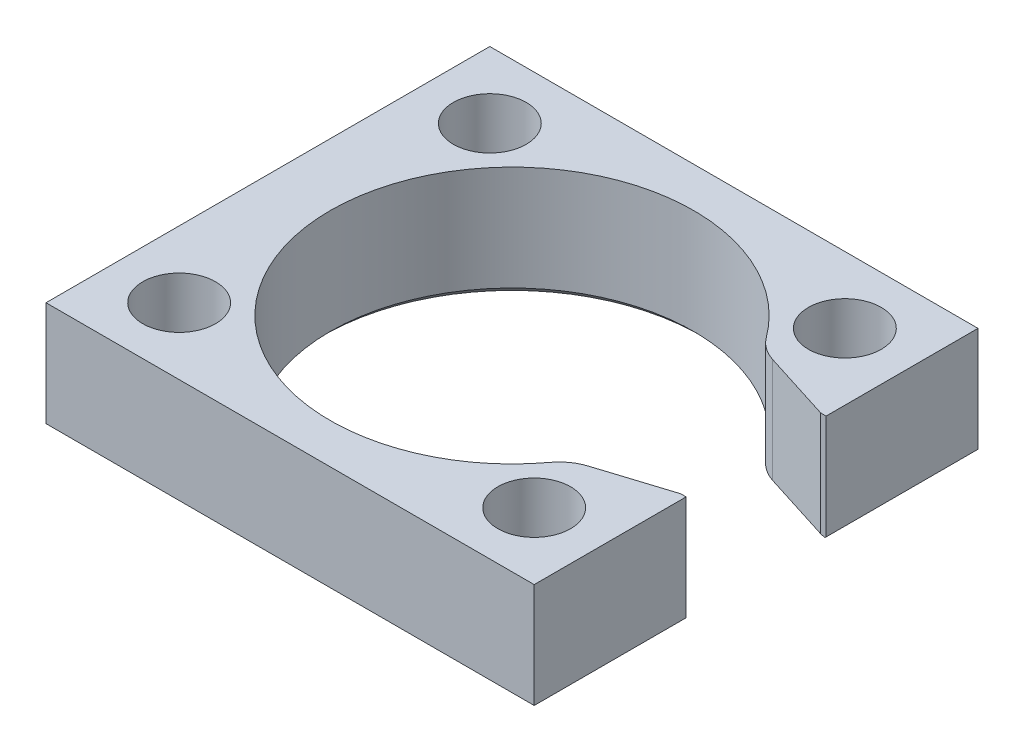
from build123d import *

# Parameters (mm, degrees)
SKETCH1_W              = 34.925
SKETCH1_H              = 31.75
PLATE_DEPTH            = 4
F_10_CLEARANCE_HOLE1_D = 5.1054
LOAD_CELL_CUTOUT_REACH = 26.919
FILLET1_R              = 3.175
CUT_EXTRUDE1_REACH     = 26.919
SKETCH5_R              = 2.6035
CHAMFER1_SIZE          = 0.508


with BuildPart() as part:
    # Sketch1 → Plate (new, symmetric)
    with BuildSketch(Plane(origin=(0, 0, 0), x_dir=(1, 0, 0), z_dir=(0, 1, 0))):
        Rectangle(SKETCH1_W, SKETCH1_H)
    extrude(amount=PLATE_DEPTH, both=True)

    # #10 Clearance Hole1 (through all)
    with Locations(Plane(origin=(0, 4, 0), x_dir=(1, 0, 0), z_dir=(0, 1, 0))):
        with Locations((-12.7, 11.1125), (12.7, 11.1125), (12.7, -11.1125), (-12.7, -11.1125)):
            Hole(F_10_CLEARANCE_HOLE1_D / 2)

    # Sketch4 → Load Cell Cutout (cut, up to next)
    with BuildSketch(Plane(origin=(0, 4, 0), x_dir=(1, 0, 0), z_dir=(0, 1, 0)), mode=Mode.PRIVATE) as load_cell_cutout_sk1:
        with BuildLine():
            Line((11.009869163, 6.927542495), (17.078427656, 5.008))
            Line((17.078427656, 5.008), (22.733, 5.008))
            Line((22.733, 5.008), (22.733, -5.008))
            Line((22.733, -5.008), (17.078427656, -5.008))
            Line((17.078427656, -5.008), (11.009869163, -6.927542495))
            ThreePointArc((11.009869163, -6.927542495), (-13.008, 0), (11.009869163, 6.927542495))
        make_face()
    load_cell_cutout_tool1 = extrude(load_cell_cutout_sk1.sketch, amount=-LOAD_CELL_CUTOUT_REACH, mode=Mode.PRIVATE) & part.part
    add(load_cell_cutout_tool1.solids().sort_by_distance((2.977457, 4, 0))[0], mode=Mode.SUBTRACT)

    # Fillet1
    fillet1_edges = [part.edges().sort_by_distance(p)[0] for p in [
        (11.009869163, 0, 6.927542495),
        (11.009869163, 0, -6.927542495),
    ]]
    fillet(fillet1_edges, radius=FILLET1_R)

    # Sketch5 → Cut-Extrude1 (cut, up to next)
    with BuildSketch(Plane(origin=(0, 4, 0), x_dir=(1, 0, 0), z_dir=(0, 1, 0)), mode=Mode.PRIVATE) as cut_extrude1_sk1:
        with Locations(Location((-12.7, 11.1125, 0), (0, 0, 270))):
            Circle(SKETCH5_R)
    cut_extrude1_tool1 = extrude(cut_extrude1_sk1.sketch, amount=-CUT_EXTRUDE1_REACH, mode=Mode.PRIVATE) & part.part
    # Sketch5 → Cut-Extrude1 (cut, up to next)
    with BuildSketch(Plane(origin=(0, 4, 0), x_dir=(1, 0, 0), z_dir=(0, 1, 0)), mode=Mode.PRIVATE) as cut_extrude1_sk2:
        with Locations(Location((12.7, 11.1125, 0), (0, 0, 270))):
            Circle(SKETCH5_R)
    cut_extrude1_tool2 = extrude(cut_extrude1_sk2.sketch, amount=-CUT_EXTRUDE1_REACH, mode=Mode.PRIVATE) & part.part
    # Sketch5 → Cut-Extrude1 (cut, up to next)
    with BuildSketch(Plane(origin=(0, 4, 0), x_dir=(1, 0, 0), z_dir=(0, 1, 0)), mode=Mode.PRIVATE) as cut_extrude1_sk3:
        with Locations(Location((-12.7, -11.1125, 0), (0, 0, 270))):
            Circle(SKETCH5_R)
    cut_extrude1_tool3 = extrude(cut_extrude1_sk3.sketch, amount=-CUT_EXTRUDE1_REACH, mode=Mode.PRIVATE) & part.part
    # Sketch5 → Cut-Extrude1 (cut, up to next)
    with BuildSketch(Plane(origin=(0, 4, 0), x_dir=(1, 0, 0), z_dir=(0, 1, 0)), mode=Mode.PRIVATE) as cut_extrude1_sk4:
        with Locations(Location((12.7, -11.1125, 0), (0, 0, 270))):
            Circle(SKETCH5_R)
    cut_extrude1_tool4 = extrude(cut_extrude1_sk4.sketch, amount=-CUT_EXTRUDE1_REACH, mode=Mode.PRIVATE) & part.part
    add(cut_extrude1_tool1.solids().sort_by_distance((-12.7, 4, -11.1125))[0], mode=Mode.SUBTRACT)
    add(cut_extrude1_tool2.solids().sort_by_distance((12.7, 4, -11.1125))[0], mode=Mode.SUBTRACT)
    add(cut_extrude1_tool3.solids().sort_by_distance((-12.7, 4, 11.1125))[0], mode=Mode.SUBTRACT)
    add(cut_extrude1_tool4.solids().sort_by_distance((12.7, 4, 11.1125))[0], mode=Mode.SUBTRACT)

    # Chamfer1
    # the kernel refuses this chamfer: 0.508 mm, written as the material it takes off along each edge
    with BuildSketch(Plane(origin=(13.009505309, -4, -9.625084967), x_dir=(-0.30158215810749167, 0, 0.9534401931485937), z_dir=(0.9534401931485937, 0, 0.30158215810749167))) as chamfer1_piece_1:
        Polygon((3.175 - CHAMFER1_SIZE, 0), (3.175, -CHAMFER1_SIZE), (3.175, 0), align=None)
    revolve(axis=Axis((13.009505309, -4, -9.625084967), (0, -1, 0)), revolution_arc=35.951449602, mode=Mode.SUBTRACT)
    with BuildSketch(Plane(origin=(18.324016186, -4, -4.614008558), x_dir=(0.30146813499365677, -0.02749587661058555, -0.9530797135354744), z_dir=(-0.9534401931485939, 0, -0.30158215810749184)), Plane(origin=(12.051981957, -4, 6.597912354), x_dir=(0.30146813499365605, -0.02749587661058387, 0.9530797135354745), z_dir=(0.9534401931485941, 0, -0.30158215810749117))) as chamfer1_piece_2:
        Polygon((CHAMFER1_SIZE * 0.999621916911, -CHAMFER1_SIZE * 0.0274958766106), (-CHAMFER1_SIZE * 0.0274958766106, -CHAMFER1_SIZE * 0.999621916911), (0, 0), align=None)
    extrude(amount=6.578319516, mode=Mode.SUBTRACT)
    with BuildSketch(Plane(origin=(17.4625, -4, -3.701585042), x_dir=(-0.9996219169112968, -0.027495876610585605, 0), z_dir=(0, 0, -1)), Plane(origin=(17.4625, -4, 17.181414958), x_dir=(-0.9996219169112968, -0.027495876610585605, 0), z_dir=(0, 0, -1))) as chamfer1_piece_3:
        Polygon((CHAMFER1_SIZE * 0.999621916911, CHAMFER1_SIZE * 0.0274958766106), (-CHAMFER1_SIZE * 0.0274958766106, CHAMFER1_SIZE * 0.999621916911), (0, 0), align=None)
    extrude(amount=13.479829916, mode=Mode.SUBTRACT)
    with BuildSketch(Plane(origin=(18.768914958, -4, -15.875), x_dir=(0, -0.027495876610585605, 0.9996219169112968), z_dir=(-1, 0, 0)), Plane(origin=(-18.768914958, -4, 15.875), x_dir=(0, -0.027495876610585605, -0.9996219169112968), z_dir=(1, 0, 0))) as chamfer1_piece_4:
        Polygon((CHAMFER1_SIZE * 0.999621916911, CHAMFER1_SIZE * 0.0274958766106), (-CHAMFER1_SIZE * 0.0274958766106, CHAMFER1_SIZE * 0.999621916911), (0, 0), align=None)
    extrude(amount=37.537829916, mode=Mode.SUBTRACT)
    with BuildSketch(Plane(origin=(-17.4625, -4, -17.181414958), x_dir=(0.9996219169112968, -0.027495876610585605, 0), z_dir=(0, 0, 1))) as chamfer1_piece_5:
        Polygon((CHAMFER1_SIZE * 0.999621916911, CHAMFER1_SIZE * 0.0274958766106), (-CHAMFER1_SIZE * 0.0274958766106, CHAMFER1_SIZE * 0.999621916911), (0, 0), align=None)
    extrude(amount=34.362829916, mode=Mode.SUBTRACT)
    with BuildSketch(Plane(origin=(13.009505309, -4, 9.625084967), x_dir=(-0.8038994814723275, 0, -0.5947651836553002), z_dir=(-0.5947651836553002, 0, 0.8038994814723275))) as chamfer1_piece_6:
        Polygon((3.175 - CHAMFER1_SIZE, 0), (3.175, -CHAMFER1_SIZE), (3.175, 0), align=None)
    revolve(axis=Axis((13.009505309, -4, 9.625084967), (0, -1, 0)), revolution_arc=35.951449602, mode=Mode.SUBTRACT)
    with BuildSketch(Plane(origin=(0, -4, 0), x_dir=(0.8038994814723273, 0, -0.5947651836553005), z_dir=(0.5947651836553005, 0, 0.8038994814723273))) as chamfer1_piece_7:
        Polygon((13.008 + CHAMFER1_SIZE, 0), (13.008, CHAMFER1_SIZE), (13.008, 0), align=None)
    revolve(axis=Axis((0, -4, 0), (0, 1, 0)), revolution_arc=287.00821123, mode=Mode.SUBTRACT)
    with BuildSketch(Plane(origin=(-12.7, -4, -11.1125), x_dir=(0, 0, 1), z_dir=(-1, 0, 0))) as chamfer1_piece_8:
        Polygon((2.6035 + CHAMFER1_SIZE, 0), (2.6035, CHAMFER1_SIZE), (2.6035, 0), align=None)
    revolve(axis=Axis((-12.7, -4, -11.1125), (0, 1, 0)), mode=Mode.SUBTRACT)
    with BuildSketch(Plane(origin=(12.7, -4, -11.1125), x_dir=(0, 0, 1), z_dir=(-1, 0, 0))) as chamfer1_piece_9:
        Polygon((2.6035 + CHAMFER1_SIZE, 0), (2.6035, CHAMFER1_SIZE), (2.6035, 0), align=None)
    revolve(axis=Axis((12.7, -4, -11.1125), (0, 1, 0)), mode=Mode.SUBTRACT)
    with BuildSketch(Plane(origin=(-12.7, -4, 11.1125), x_dir=(0, 0, 1), z_dir=(-1, 0, 0))) as chamfer1_piece_10:
        Polygon((2.6035 + CHAMFER1_SIZE, 0), (2.6035, CHAMFER1_SIZE), (2.6035, 0), align=None)
    revolve(axis=Axis((-12.7, -4, 11.1125), (0, 1, 0)), mode=Mode.SUBTRACT)
    with BuildSketch(Plane(origin=(12.7, -4, 11.1125), x_dir=(0, 0, 1), z_dir=(-1, 0, 0))) as chamfer1_piece_11:
        Polygon((2.6035 + CHAMFER1_SIZE, 0), (2.6035, CHAMFER1_SIZE), (2.6035, 0), align=None)
    revolve(axis=Axis((12.7, -4, 11.1125), (0, 1, 0)), mode=Mode.SUBTRACT)


solid = part.part
